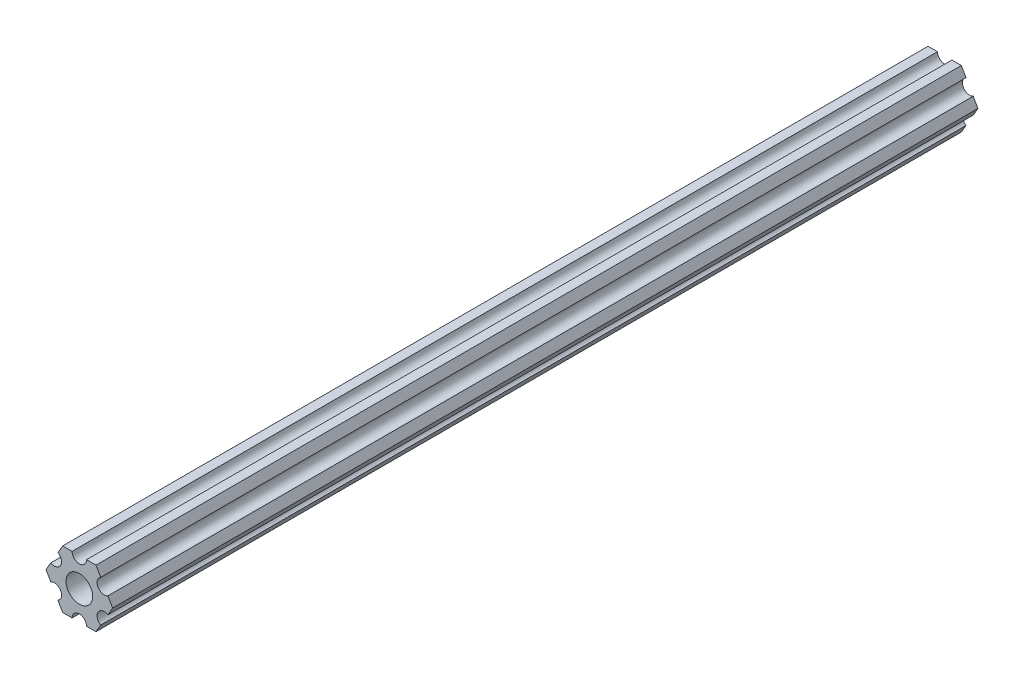
from build123d import *

# Parameters (mm, degrees)
SKETCH1_R           = 2.9337
BOSS_EXTRUDE1_DEPTH = 190.5


with BuildPart() as part:
    # Sketch1 → Boss-Extrude1 (new body)
    with BuildSketch(Plane(origin=(0, 0, 0), x_dir=(-1, 0, 0), z_dir=(0, 0, -1))):
        with BuildLine():
            Line((-4.70551159, -4.549815043), (-3.666174521, -6.349999904))
            Line((-3.666174521, -6.349999904), (-1.587500385, -6.349999904))
            ThreePointArc((-1.587500385, -6.349999904), (-3.85e-07, -4.762499904), (1.587499615, -6.349999904))
            Line((1.587499615, -6.349999904), (3.666173825, -6.349999904))
            Line((3.666173825, -6.349999904), (4.705510942, -4.54981524))
            ThreePointArc((4.705510942, -4.54981524), (4.124445629, -2.381249907), (6.293010962, -1.800184594))
            Line((6.293010962, -1.800184594), (7.332348079, 7e-08))
            Line((7.332348079, 7e-08), (6.293011217, 1.800184685))
            ThreePointArc((6.293011217, 1.800184685), (4.124445939, 2.381250203), (4.705511457, 4.549815481))
            Line((4.705511457, 4.549815481), (3.666174521, 6.350000222))
            Line((3.666174521, 6.350000222), (1.587500385, 6.350000222))
            ThreePointArc((1.587500385, 6.350000222), (3.85e-07, 4.762500222), (-1.587499615, 6.350000222))
            Line((-1.587499615, 6.350000222), (-3.666173825, 6.350000222))
            Line((-3.666173825, 6.350000222), (-4.705511038, 4.549815614))
            ThreePointArc((-4.705511038, 4.549815614), (-4.124445841, 2.38125025), (-6.293011205, 1.800185053))
            Line((-6.293011205, 1.800185053), (-7.332348419, 4.44e-07))
            Line((-7.332348419, 4.44e-07), (-6.293011423, -1.80018429))
            ThreePointArc((-6.293011423, -1.80018429), (-4.12444613, -2.38124975), (-4.70551159, -4.549815043))
        make_face()
        Circle(SKETCH1_R, mode=Mode.SUBTRACT)
    extrude(amount=BOSS_EXTRUDE1_DEPTH)


solid = part.part
